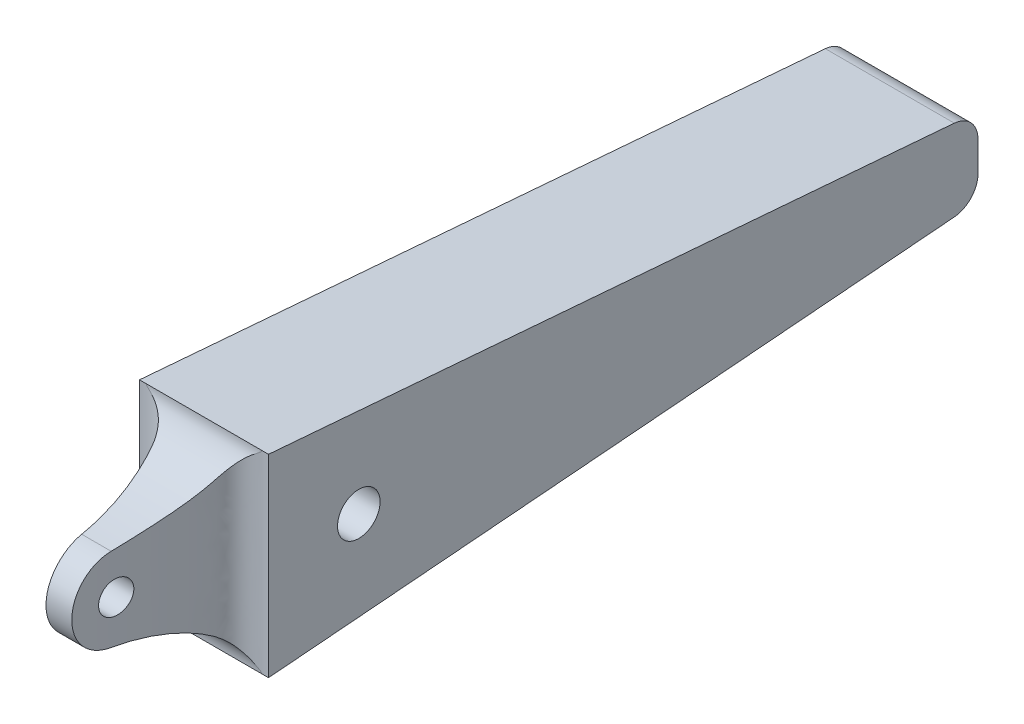
from build123d import *

# Parameters (mm, degrees)
SKETCH1_R               = 1.25
SKETCH1_R_2             = 1.65
BOSS_EXTRUDE1_DEPTH     = 10
FILLET3_R               = 2
CUT_EXTRUDE1_DEPTH      = 68.418932925
CUT_EXTRUDE1_DEPTH_BACK = 68.418932925


with BuildPart() as part:
    # Sketch1 → Boss-Extrude1 (new body)
    with BuildSketch(Plane.YZ):
        with BuildLine():
            Line((3, 0), (-3, 0))
            Line((-3, 0), (-7.5, 55))
            add(Edge.make_bspline(
                [(-7.5, 55), (-4.109267796, 55), (-3.23217472, 63.339921436)],
                knots=[3.141592654, 3.141592654, 3.141592654, 4.450740113, 4.450740113, 4.450740113], degree=2, weights=[1, 0.793307522, 1]))
            ThreePointArc((-3.23217472, 63.339921436), (0, 66.25), (3.23217472, 63.339921436))
            add(Edge.make_bspline(
                [(3.23217472, 63.339921436), (4.109267796, 55), (7.5, 55)],
                knots=[1.832445194, 1.832445194, 1.832445194, 3.141592654, 3.141592654, 3.141592654], degree=2, weights=[1, 0.793307522, 1]))
            Line((7.5, 55), (3, 0))
        make_face()
        with Locations((0, 63)):
            Circle(SKETCH1_R, mode=Mode.SUBTRACT)
        with Locations((0, 48)):
            Circle(SKETCH1_R_2, mode=Mode.SUBTRACT)
    extrude(amount=BOSS_EXTRUDE1_DEPTH)

    # Fillet3
    fillet3_edges = [part.edges().sort_by_distance(p)[0] for p in [
        (5, 3, 0),
        (5, -3, 0),
    ]]
    fillet(fillet3_edges, radius=FILLET3_R)

    # Sketch4 → Cut-Extrude1 (cut, two sides: drawn at the far end of the back side and taken through both)
    with BuildSketch(Plane(origin=(0, 0, 0), x_dir=(-1, 0, 0), z_dir=(0, 1, 0)).offset(-CUT_EXTRUDE1_DEPTH_BACK)):
        with BuildLine():
            Line((-10, 66.25), (-10, 55))
            add(Edge.make_bspline(
                [(-6, 66.25), (-6.064946282, 62.354809485), (-6.776507729, 58.438723113), (-7.892060413, 54.898049823), (-10, 55)],
                knots=[0, 0, 0, 0, 0.696387324, 1, 1, 1, 1], degree=3))
            Line((-6, 66.25), (-10, 66.25))
        make_face()
        with BuildLine():
            Line((0, 66.25), (-4, 66.25))
            add(Edge.make_bspline(
                [(-4, 66.25), (-3.935053718, 62.354809485), (-3.223492271, 58.438723113), (-2.107939587, 54.898049823), (0, 55)],
                knots=[0, 0, 0, 0, 0.696387324, 1, 1, 1, 1], degree=3))
            Line((0, 55), (0, 66.25))
        make_face()
    extrude(amount=CUT_EXTRUDE1_DEPTH + CUT_EXTRUDE1_DEPTH_BACK, mode=Mode.SUBTRACT)


solid = part.part
